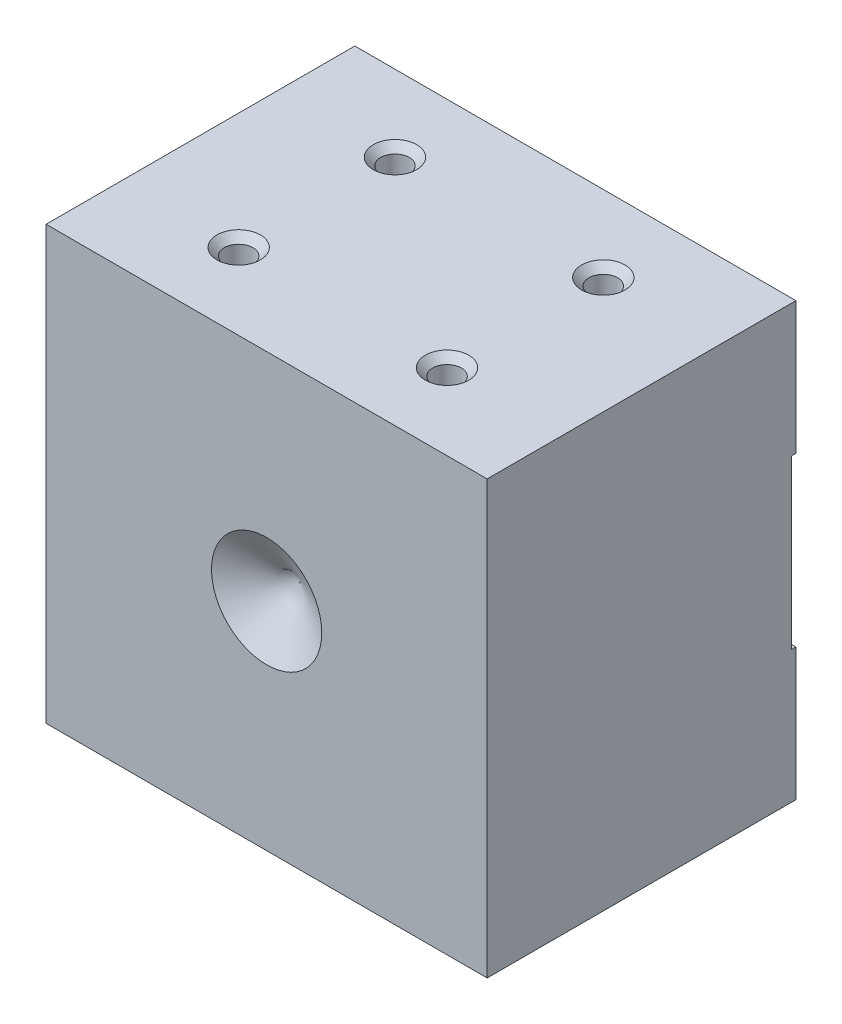
from build123d import *

# Parameters (mm, degrees)
SKETCH1_W                       = 49.784
SKETCH1_H                       = 35.56
BOSS_EXTRUDE1_DEPTH             = 50.8
M4X0_7_TAPPED_HOLE1_AT_2_COUNT  = 2
M4X0_7_TAPPED_HOLE1_AT_2_PITCH  = 30
M4X0_7_TAPPED_HOLE1_AT_3_COUNT  = 2
M4X0_7_TAPPED_HOLE1_AT_3_PITCH  = 18
M4X0_7_TAPPED_HOLE1_AT_4_COUNT  = 2
M4X0_7_TAPPED_HOLE1_AT_4_PITCH  = 24
CUT_EXTRUDE2_DEPTH              = 0.508
MIRROR2_START                   = -17.78
MIRROR2_DEPTH                   = 0.508
M5X0_8_TAPPED_HOLE1_D           = 4.2
M5X0_8_TAPPED_HOLE1_DEPTH       = 12.192
M5X0_8_TAPPED_HOLE1_CSINK_D     = 6
M5X0_8_TAPPED_HOLE1_CSINK_ANGLE = 90
M5X0_8_TAPPED_HOLE1_TIP         = 1.2618073


# Read off the part's stored shape, not the designer's step: Mirror2
with BuildPart() as part:
    # Sketch1 → Boss-Extrude1 (new body)
    with BuildSketch(Plane.YZ):
        Rectangle(SKETCH1_W, SKETCH1_H)
    extrude(amount=BOSS_EXTRUDE1_DEPTH)

    # Sketch3 → M4x0.7 Tapped Hole1 (revolve, cut)
    with BuildSketch(Plane(origin=(13.4, -24.892, -9), x_dir=(0, 0, -1), z_dir=(1, 0, 0))):
        Polygon((0, 0), (0, 10.897420021), (1.65, 9.906), (1.65, 0.85), (2.5, 0), align=None)
    m4x0_7_tapped_hole1 = revolve(axis=Axis((13.4, -31.242, -9), (0, 1, 0)), mode=Mode.SUBTRACT)

    # M4x0.7 Tapped Hole1 at 2: M4x0.7 Tapped Hole1 ×2
    with Locations(*[Vector(0.8000000000000002, 0, 0.5999999999999998) * (i * M4X0_7_TAPPED_HOLE1_AT_2_PITCH) for i in range(1, M4X0_7_TAPPED_HOLE1_AT_2_COUNT)]):
        add(m4x0_7_tapped_hole1, mode=Mode.SUBTRACT)

    # M4x0.7 Tapped Hole1 at 3: M4x0.7 Tapped Hole1 ×2
    with Locations(*[(0, 0, i * M4X0_7_TAPPED_HOLE1_AT_3_PITCH) for i in range(1, M4X0_7_TAPPED_HOLE1_AT_3_COUNT)]):
        add(m4x0_7_tapped_hole1, mode=Mode.SUBTRACT)

    # M4x0.7 Tapped Hole1 at 4: M4x0.7 Tapped Hole1 ×2
    with Locations(*[(i * M4X0_7_TAPPED_HOLE1_AT_4_PITCH, 0, 0) for i in range(1, M4X0_7_TAPPED_HOLE1_AT_4_COUNT)]):
        add(m4x0_7_tapped_hole1, mode=Mode.SUBTRACT)

    # Mirror1: M4x0.7 Tapped Hole1 across plane
    add(m4x0_7_tapped_hole1.mirror(Plane.ZX), mode=Mode.SUBTRACT)

    # Mirror1 copy 1 sketch → Mirror1 copy 1 (revolve, cut)
    with BuildSketch(Plane(origin=(37.4, 24.892, 9), x_dir=(0, 0, -1), z_dir=(1, 0, 0))):
        Polygon((0, 0), (0, -10.897420021), (1.65, -9.906), (1.65, -0.85), (2.5, 0), align=None)
    revolve(axis=Axis((37.4, 31.242, 9), (0, 1, 0)), mode=Mode.SUBTRACT)

    # Mirror1 copy 2 sketch → Mirror1 copy 2 (revolve, cut)
    with BuildSketch(Plane(origin=(13.4, 24.892, 9), x_dir=(0, 0, -1), z_dir=(1, 0, 0))):
        Polygon((0, 0), (0, -10.897420021), (1.65, -9.906), (1.65, -0.85), (2.5, 0), align=None)
    revolve(axis=Axis((13.4, 31.242, 9), (0, 1, 0)), mode=Mode.SUBTRACT)

    # Mirror1 copy 3 sketch → Mirror1 copy 3 (revolve, cut)
    with BuildSketch(Plane(origin=(37.4, 24.892, -9), x_dir=(0, 0, -1), z_dir=(1, 0, 0))):
        Polygon((0, 0), (0, -10.897420021), (1.65, -9.906), (1.65, -0.85), (2.5, 0), align=None)
    revolve(axis=Axis((37.4, 31.242, -9), (0, 1, 0)), mode=Mode.SUBTRACT)

    # Sketch5 → Cut-Revolve1 (revolve, cut)
    with BuildSketch(Plane(origin=(0, 0, 0), x_dir=(-1, 0, 0), z_dir=(0, 1, 0))):
        Polygon((-25.4, 17.78), (-25.4, 13.964535069), (-31.75, 17.78), align=None)
    revolve(axis=Axis((25.4, 0, 17.78), (0, 0, -1)), mode=Mode.SUBTRACT)

    # Sketch9 → Cut-Extrude2 (cut)
    with BuildSketch(Plane(origin=(0, 0, -17.78), x_dir=(1, 0, 0), z_dir=(0, 0, -1))):
        with BuildLine():
            Line((25.4, 12.7), (31.75, 12.7))
            ThreePointArc((31.75, 12.7), (34.925, 15.875), (38.1, 12.7))
            Line((38.1, 12.7), (38.1, 9.652))
            Line((38.1, 9.652), (50.8, 9.652))
            Line((50.8, 9.652), (50.8, 0))
            Line((50.8, 0), (25.4, 0))
            Line((25.4, 0), (25.4, 12.7))
        make_face()
    extrude(amount=-CUT_EXTRUDE2_DEPTH, mode=Mode.SUBTRACT)

    # Mirror2 outline → Mirror2 (cut)
    with BuildSketch(Plane.XY.offset(MIRROR2_START)):
        with BuildLine():
            Line((38.1, 9.652), (38.1, 12.7))
            ThreePointArc((38.1, 12.7), (34.925, 15.875), (31.75, 12.7))
            Line((31.75, 12.7), (19.05, 12.7))
            ThreePointArc((19.05, 12.7), (15.875, 15.875), (12.7, 12.7))
            Line((12.7, 12.7), (12.7, 9.652))
            Line((12.7, 9.652), (0, 9.652))
            Line((0, 9.652), (0, -9.652))
            Line((0, -9.652), (12.7, -9.652))
            Line((12.7, -9.652), (12.7, -12.7))
            ThreePointArc((12.7, -12.7), (15.875, -15.875), (19.05, -12.7))
            Line((19.05, -12.7), (25.4, -12.7))
            Line((25.4, -12.7), (25.4, 0))
            Line((25.4, 0), (50.8, 0))
            Line((50.8, 0), (50.8, 9.652))
            Line((50.8, 9.652), (38.1, 9.652))
        make_face()
    extrude(amount=MIRROR2_DEPTH, mode=Mode.SUBTRACT)

    # M5x0.8 Tapped Hole1
    with Locations(Plane(origin=(0, 0, -17.272), x_dir=(1, 0, 0), z_dir=(0, 0, -1))):
        with Locations((44.45, 0)):
            CounterSinkHole(M5X0_8_TAPPED_HOLE1_D / 2, M5X0_8_TAPPED_HOLE1_CSINK_D / 2, depth=M5X0_8_TAPPED_HOLE1_DEPTH, counter_sink_angle=M5X0_8_TAPPED_HOLE1_CSINK_ANGLE)
            with Locations((0, 0, -(M5X0_8_TAPPED_HOLE1_DEPTH + M5X0_8_TAPPED_HOLE1_TIP / 2))):  # 118° drill point
                Cone(0, M5X0_8_TAPPED_HOLE1_D / 2, M5X0_8_TAPPED_HOLE1_TIP, mode=Mode.SUBTRACT)


solid = part.part
